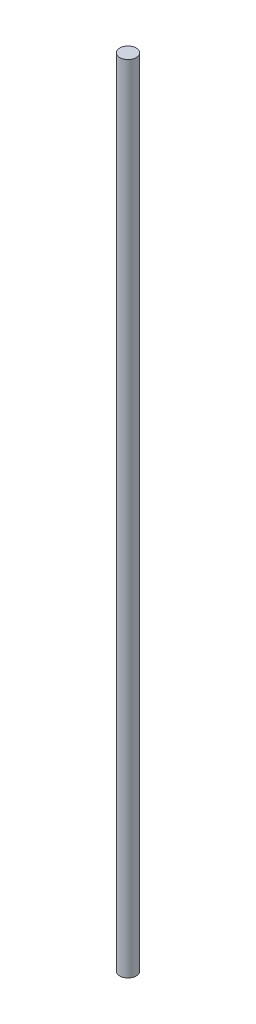
from build123d import *

# Parameters (mm, degrees)
SKETCH1_R           = 6.35
BOSS_EXTRUDE1_DEPTH = 304.8


with BuildPart() as part:
    # Sketch1 → Boss-Extrude1 (new, symmetric)
    with BuildSketch(Plane(origin=(0, 0, 0), x_dir=(1, 0, 0), z_dir=(0, 1, 0))):
        Circle(SKETCH1_R)
    extrude(amount=BOSS_EXTRUDE1_DEPTH, both=True)


solid = part.part
